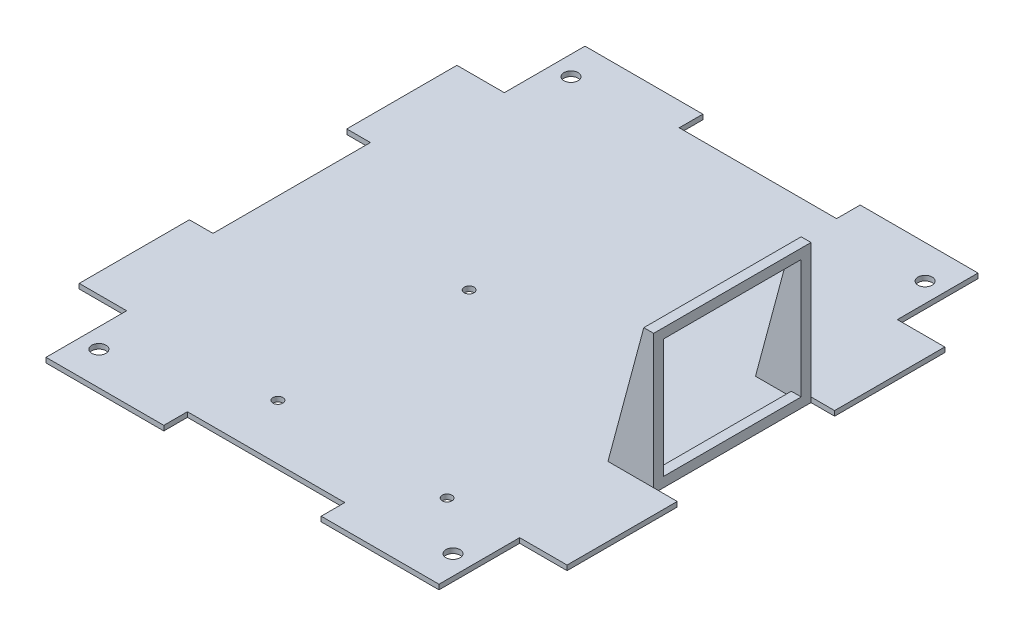
from build123d import *

# Parameters (mm, degrees)
SKETCH1_R           = 2.286
MAIN_BODY_DEPTH     = 1.5875
SKETCH2_W           = 3.175
SKETCH2_H           = 50.8
BOSS_EXTRUDE1_DEPTH = 43.18
CUT_EXTRUDE1_REACH  = 180.97
SKETCH3_W           = 44.45
SKETCH3_H           = 38.4175
BOSS_EXTRUDE2_DEPTH = 3.175
CUT_EXTRUDE2_REACH  = 127.031
SKETCH5_R           = 1.5875


with BuildPart() as part:
    # Sketch1 → Main Body (new body)
    with BuildSketch(Plane(origin=(0, 0, 0), x_dir=(1, 0, 0), z_dir=(0, 1, 0))):
        Polygon((-25.4, 86.995), (-63.43142, 86.995), (-63.43142, 60.96), (-78.74, 60.96), (-78.74, 25.4), (-71.12, 25.4), (-71.12, -25.4), (-78.74, -25.4), (-78.74, -60.96), (-63.43142, -60.96), (-63.43142, -86.995), (-25.4, -86.995), (-25.4, -79.375), (25.4, -79.375), (25.4, -86.995), (63.43142, -86.995), (63.43142, -60.96), (78.74, -60.96), (78.74, -25.4), (71.12, -25.4), (71.12, 25.4), (78.74, 25.4), (78.74, 60.96), (63.43142, 60.96), (63.43142, 86.995), (25.4, 86.995), (25.4, 79.375), (-25.4, 79.375), align=None)
        with Locations((-57.15, 76.2)):
            Circle(SKETCH1_R, mode=Mode.SUBTRACT)
        with Locations((57.15, 76.2)):
            Circle(SKETCH1_R, mode=Mode.SUBTRACT)
        with Locations((57.15, -76.2)):
            Circle(SKETCH1_R, mode=Mode.SUBTRACT)
        with Locations((-57.15, -76.2)):
            Circle(SKETCH1_R, mode=Mode.SUBTRACT)
    extrude(amount=MAIN_BODY_DEPTH)

    # Sketch2 → Boss-Extrude1 (add)
    with BuildSketch(Plane(origin=(0, 1.5875, 0), x_dir=(1, 0, 0), z_dir=(0, 1, 0))):
        with Locations((69.5325, 0)):
            Rectangle(SKETCH2_W, SKETCH2_H)
    extrude(amount=BOSS_EXTRUDE1_DEPTH)

    # Sketch3 → Cut-Extrude1 (cut, up to next)
    with BuildSketch(Plane(origin=(71.12, 0, 0), x_dir=(0, 0, -1), z_dir=(1, 0, 0)), mode=Mode.PRIVATE) as cut_extrude1_sk1:
        with Locations((0, 22.38375)):
            Rectangle(SKETCH3_W, SKETCH3_H)
    cut_extrude1_tool1 = extrude(cut_extrude1_sk1.sketch, amount=-CUT_EXTRUDE1_REACH, mode=Mode.PRIVATE) & part.part
    add(cut_extrude1_tool1.solids().sort_by_distance((71.12, 22.38375, 0))[0], mode=Mode.SUBTRACT)

    # Sketch4 → Boss-Extrude2 (add)
    with BuildSketch(Plane(origin=(0, 0, -25.4), x_dir=(-1, 0, 0), z_dir=(0, 0, -1))):
        Polygon((-56.374953871, 1.5875), (-67.945, 44.7675), (-67.945, 1.5875), align=None)
    boss_extrude2 = extrude(amount=-BOSS_EXTRUDE2_DEPTH)

    # Mirror1: Boss-Extrude2 across plane
    add(boss_extrude2.mirror(Plane.XY))

    # Sketch5 → Cut-Extrude2 (cut, up to next)
    with BuildSketch(Plane(origin=(0, 1.5875, 0), x_dir=(1, 0, 0), z_dir=(0, 1, 0)), mode=Mode.PRIVATE) as cut_extrude2_sk1:
        with Locations((-13.97, 0.127)):
            Circle(SKETCH5_R)
    cut_extrude2_tool1 = extrude(cut_extrude2_sk1.sketch, amount=-CUT_EXTRUDE2_REACH, mode=Mode.PRIVATE) & part.part
    # Sketch5 → Cut-Extrude2 (cut, up to next)
    with BuildSketch(Plane(origin=(0, 1.5875, 0), x_dir=(1, 0, 0), z_dir=(0, 1, 0)), mode=Mode.PRIVATE) as cut_extrude2_sk2:
        with Locations((40.64, 0.127)):
            Circle(SKETCH5_R)
    cut_extrude2_tool2 = extrude(cut_extrude2_sk2.sketch, amount=-CUT_EXTRUDE2_REACH, mode=Mode.PRIVATE) & part.part
    # Sketch5 → Cut-Extrude2 (cut, up to next)
    with BuildSketch(Plane(origin=(0, 1.5875, 0), x_dir=(1, 0, 0), z_dir=(0, 1, 0)), mode=Mode.PRIVATE) as cut_extrude2_sk3:
        with Locations((40.64, -61.595)):
            Circle(SKETCH5_R)
    cut_extrude2_tool3 = extrude(cut_extrude2_sk3.sketch, amount=-CUT_EXTRUDE2_REACH, mode=Mode.PRIVATE) & part.part
    # Sketch5 → Cut-Extrude2 (cut, up to next)
    with BuildSketch(Plane(origin=(0, 1.5875, 0), x_dir=(1, 0, 0), z_dir=(0, 1, 0)), mode=Mode.PRIVATE) as cut_extrude2_sk4:
        with Locations((-13.97, -61.595)):
            Circle(SKETCH5_R)
    cut_extrude2_tool4 = extrude(cut_extrude2_sk4.sketch, amount=-CUT_EXTRUDE2_REACH, mode=Mode.PRIVATE) & part.part
    add(cut_extrude2_tool1.solids().sort_by_distance((-13.97, 1.5875, -0.127))[0], mode=Mode.SUBTRACT)
    add(cut_extrude2_tool2.solids().sort_by_distance((40.64, 1.5875, -0.127))[0], mode=Mode.SUBTRACT)
    add(cut_extrude2_tool3.solids().sort_by_distance((40.64, 1.5875, 61.595))[0], mode=Mode.SUBTRACT)
    add(cut_extrude2_tool4.solids().sort_by_distance((-13.97, 1.5875, 61.595))[0], mode=Mode.SUBTRACT)


solid = part.part
